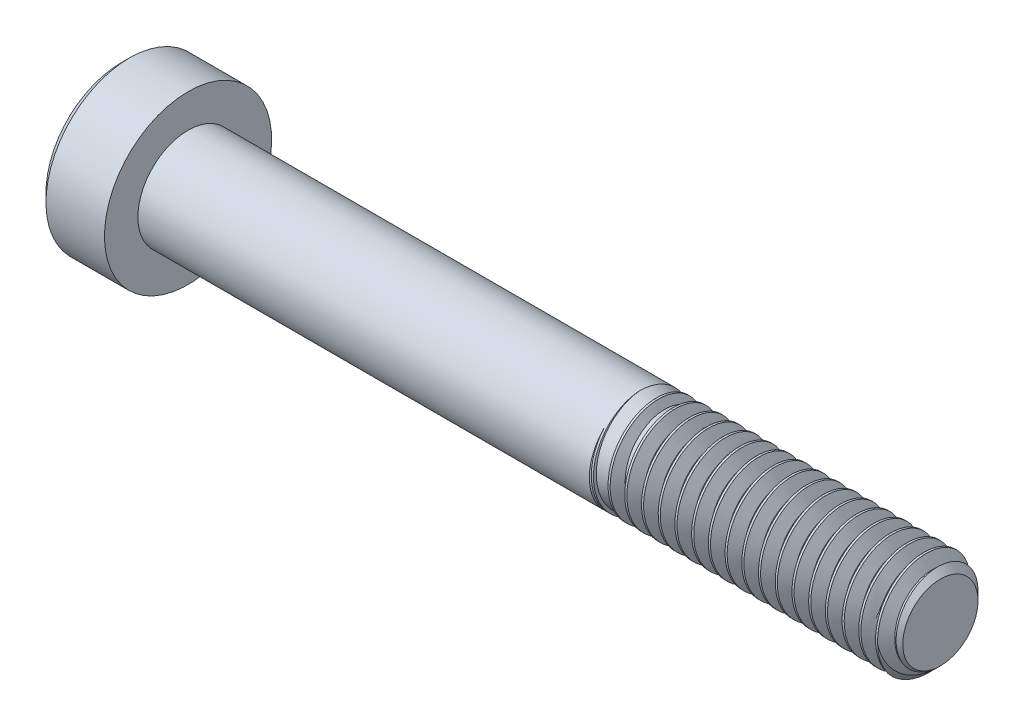
from build123d import *

# Parameters (mm, degrees)
SKETCH2_R           = 3
BOSS_EXTRUDE1_DEPTH = 18
CHAMFER1_SIZE       = 0.75
CUT_EXTRUDE1_DEPTH  = 3.12
CUT_SWEEP1_PITCH    = 1
CUT_SWEEP1_TO       = 18


with BuildPart() as part:
    # Sketch2 → Boss-Extrude1 (new body)
    with BuildSketch(Plane(origin=(22.5, 0, 0), x_dir=(0, 0, -1), z_dir=(1, 0, 0))):
        Circle(SKETCH2_R)
    extrude(amount=-BOSS_EXTRUDE1_DEPTH)

    # Chamfer1
    chamfer1_edges = [part.edges().sort_by_distance(p)[0] for p in [
        (22.5, 0, 3),
    ]]
    chamfer(chamfer1_edges, length=CHAMFER1_SIZE)

    # Sketch10 → Revolve2 (revolve)
    with BuildSketch(Plane.XY, mode=Mode.PRIVATE) as revolve2_sk:
        Polygon((6.232050808, 0), (4.5, 3), (-22.5, 3), (-22.5, 0), align=None)
    revolve(revolve2_sk.sketch.rotate(Axis((-22.5, 0, 0), (1, 0, 0)), 270), axis=Axis((-22.5, 0, 0), (1, 0, 0)))

    # Sketch6 → Revolve1 (revolve)
    with BuildSketch(Plane.XY):
        Polygon((-26, 5), (-26.5, 4.5), (-26.5, 0), (-22.5, 0), (-22.5, 5), align=None)
    revolve(axis=Axis((-22.5, 0, 0), (-1, 0, 0)))

    # Sketch4 → Cut-Extrude1 (cut)
    with BuildSketch(Plane(origin=(-26.5, 0, 0), x_dir=(0, 0, -1), z_dir=(1, 0, 0))):
        Polygon((0, 2.309401077), (-2, 1.154700538), (-2, -1.154700538), (0, -2.309401077), (2, -1.154700538), (2, 1.154700538), align=None)
    extrude(amount=CUT_EXTRUDE1_DEPTH, mode=Mode.SUBTRACT)

    # Cut-Extrude2 cone 1 section (through the dimple's axis) → Cut-Extrude2 (revolve, cut)
    with BuildSketch(Plane(origin=(-26.5, 0, 0), x_dir=(0, 0, 1), z_dir=(0, 1, 0))):
        Polygon((0, 0), (2.309401077, 0), (0, 2.309401077), align=None)
    revolve(axis=Axis((-26.5, 0, 0), (1, 0, 0)), mode=Mode.SUBTRACT)


with BuildPart() as body_2:
    # Split1: the piece on the far side of the plane
    add(part.part)
    split(bisect_by=Plane(origin=(4.5, 3, 0), x_dir=(0, 0, -1), z_dir=(-1, 0, 0)), keep=Keep.BOTTOM)

    # Cut-Sweep1: arcs per turn and ends read off the stored shape
    # Cut-Sweep1: the profile of Sketch5 screwed along a right-hand helix through 19 turns, 8 arcs to a turn; built about Z, then put on its axis
    cut_sweep1_z = Axis((0, 0, 0), (0, 0, 1))
    cut_sweep1_corners = [(3.054126588, 0, 0.03125), (3.054126588, 0, -0.90625), (2.350480947, 0, -0.5), (2.350480947, 0, -0.375)]
    with BuildLine(mode=Mode.PRIVATE) as cut_sweep1_profile:
        Line(cut_sweep1_corners[0], cut_sweep1_corners[1])
        Line(cut_sweep1_corners[1], cut_sweep1_corners[2])
        Line(cut_sweep1_corners[2], cut_sweep1_corners[3])
        Line(cut_sweep1_corners[3], cut_sweep1_corners[0])
    cut_sweep1_cap = Face(cut_sweep1_profile.wire())
    cut_sweep1_turn_angles = [0, 22.5, 45, 67.5, 90, 112.5, 135, 157.5, 180, 202.5, 225, 247.5, 270, 292.5, 315, 337.5, 360]
    cut_sweep1_turn_weights = [1, 0.9238795325112867, 1, 0.9238795325112867, 1, 0.9238795325112867, 1, 0.9238795325112867, 1, 0.9238795325112867, 1, 0.9238795325112867, 1, 0.9238795325112867, 1, 0.9238795325112867, 1]
    cut_sweep1_turn_rails = [Edge.make_bspline([Vector(p[0], p[1], 0).rotate(cut_sweep1_z, cut_sweep1_turn_angles[k]) / cut_sweep1_turn_weights[k] + Vector(0, 0, p[2] + CUT_SWEEP1_PITCH * cut_sweep1_turn_angles[k] / 360) for k in range(17)], [0, 0, 0, 1, 1, 2, 2, 3, 3, 4, 4, 5, 5, 6, 6, 7, 7, 8, 8, 8], 2, cut_sweep1_turn_weights) for p in cut_sweep1_corners]
    cut_sweep1_turn_sides = [Face.make_surface_from_curves(cut_sweep1_turn_rails[p[0]], cut_sweep1_turn_rails[p[1]]) for p in [(0, 1), (1, 2), (2, 3), (3, 0)]]
    cut_sweep1 = Plane(origin=(22.5, 0, 0), x_dir=(0, 1, 0), z_dir=(-1, 0, 0)) * split(Solid(Shell([*[p.moved(Location((0, 0, CUT_SWEEP1_PITCH * i))) for i in range(19) for p in cut_sweep1_turn_sides], cut_sweep1_cap, cut_sweep1_cap.rotate(cut_sweep1_z, 6840).moved(Location((0, 0, CUT_SWEEP1_PITCH * 6840 / 360)))])), bisect_by=Plane.XY.offset(CUT_SWEEP1_TO), keep=Keep.BOTTOM, mode=Mode.PRIVATE)
    add(cut_sweep1, mode=Mode.SUBTRACT)


with BuildPart() as part_1:
    add(part.part)

    # Split1
    split(bisect_by=Plane(origin=(4.5, 3, 0), x_dir=(0, 0, -1), z_dir=(-1, 0, 0)), keep=Keep.TOP)

    add(body_2.part)  # Boss-Extrude2 merges body 2
    # Boss-Extrude2 cone 1 section (through the dimple's axis) → Boss-Extrude2 (revolve)
    with BuildSketch(Plane(origin=(4.5, 0, 0), x_dir=(0, 0, 1), z_dir=(0, 1, 0))):
        Polygon((0, 0), (3, 0), (0, 8.242432258), align=None)
    revolve(axis=Axis((4.5, 0, 0), (1, 0, 0)))


solid = part_1.part
